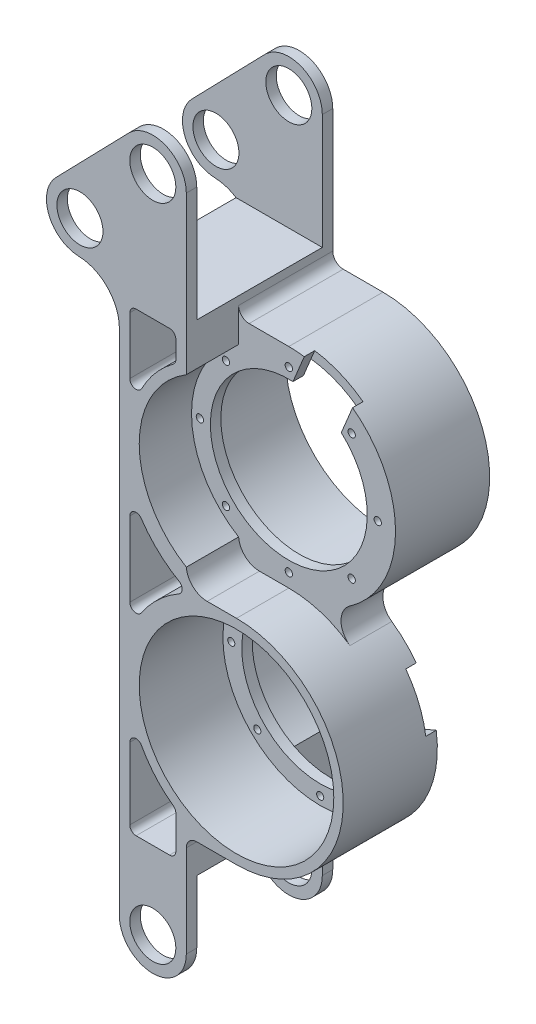
from build123d import *

# Parameters (mm, degrees)
SKETCH_1_R                = 11
EXTRUDE_1_DEPTH           = 70
FILLET_1_R                = 5
SKETCH_2_R                = 46.5
CUT_EXTRUDE_1_DEPTH       = 40
SKETCH_3_R                = 46.5
CUT_EXTRUDE_2_DEPTH       = 40
CUT_EXTRUDE_3_DEPTH       = 25
CUT_EXTRUDE_START         = -25
CUT_EXTRUDE_4_DEPTH       = 25
CUT_EXTRUDE_START_2       = -30
CUT_EXTRUDE_5_DEPTH       = 30
FILLET_2_R                = 10
CUT_EXTRUDE_6_DEPTH       = 346.603819461
CUT_EXTRUDE_6_DEPTH_BACK  = 346.603819461
SKETCH_8_R                = 37.5
CUT_EXTRUDE_7_DEPTH       = 347.534269631
CUT_EXTRUDE_7_DEPTH_BACK  = 347.534269631
SKETCH_9_W                = 60
SKETCH_9_H                = 60
SKETCH_9_H_2              = 100
CUT_EXTRUDE_8_DEPTH       = 351.34554376
CUT_EXTRUDE_8_DEPTH_BACK  = 351.34554376
CUT_EXTRUDE_9_DEPTH       = 351.34554376
CUT_EXTRUDE_9_DEPTH_BACK  = 351.34554376
FILLET_3_R                = 20
FILLET_4_R                = 3
SKETCH_12_R               = 46.5
CUT_EXTRUDE_10_DEPTH      = 25
SKETCH_13_R               = 46.5
CUT_EXTRUDE_11_DEPTH      = 25
CUT_EXTRUDE_12_DEPTH      = 351.345543854
CUT_EXTRUDE_12_DEPTH_BACK = 351.345543854
FILLET_5_R                = 10
FILLET_6_R                = 3
CUT_EXTRUDE_13_DEPTH      = 346.603819557
CUT_EXTRUDE_13_DEPTH_BACK = 346.603819557
SKETCH_15_R               = 1.75
SKETCH_15_R_2             = 1.7
CUT_EXTRUDE_14_DEPTH      = 5
CUT_EXTRUDE_15_DEPTH      = 5


with BuildPart() as part:
    # 草图1 → 凸台-拉伸1 (new body)
    with BuildSketch(Plane.XY):
        with BuildLine():
            Line((-11.476408706, 326.148634141), (-46.315890396, 290.284856933))
            ThreePointArc((-46.315890396, 290.284856933), (-49.576817715, 272.906381151), (-34.839481689, 263.136222792))
            Line((-34.839481689, 263.136222792), (-16, 263.136222792))
            Line((-16, 263.136222792), (-16, 0))
            ThreePointArc((-16, 0), (0, -16), (16, 0))
            Line((16, 0), (16, 49))
            Line((16, 49), (40, 49))
            ThreePointArc((40, 49), (76.062445841, 63.937554159), (91, 100))
            Line((91, 100), (91, 200))
            ThreePointArc((91, 200), (76.062445841, 236.062445841), (40, 251))
            Line((40, 251), (16, 251))
            Line((16, 251), (16, 315))
            ThreePointArc((16, 315), (6.01570697, 329.82603351), (-11.476408706, 326.148634141))
        make_face()
        with Locations((0, 315)):
            Circle(SKETCH_1_R, mode=Mode.SUBTRACT)
        Circle(SKETCH_1_R, mode=Mode.SUBTRACT)
        with Locations((-34.839481689, 279.136222792)):
            Circle(SKETCH_1_R, mode=Mode.SUBTRACT)
    extrude(amount=EXTRUDE_1_DEPTH)

    # 圆角1
    fillet_1_edges = [part.edges().sort_by_distance(p)[0] for p in [
        (16, 251, 35),
        (16, 49, 35),
    ]]
    fillet(fillet_1_edges, radius=FILLET_1_R)

    # 草图2 → 切除-拉伸1 (cut)
    with BuildSketch(Plane.XY.offset(70)):
        with Locations((40, 100)):
            Circle(SKETCH_2_R)
    extrude(amount=-CUT_EXTRUDE_1_DEPTH, mode=Mode.SUBTRACT)

    # 草图3 → 切除-拉伸2 (cut)
    with BuildSketch(Plane(origin=(0, 0, 0), x_dir=(-1, 0, 0), z_dir=(0, 0, -1))):
        with Locations((-40, 200)):
            Circle(SKETCH_3_R)
    extrude(amount=-CUT_EXTRUDE_2_DEPTH, mode=Mode.SUBTRACT)

    # 草图4 → 切除-拉伸3 (cut)
    with BuildSketch(Plane(origin=(0, 0, 0), x_dir=(-1, 0, 0), z_dir=(0, 0, -1))):
        with BuildLine():
            Line((-16, 44), (-16, 49))
            Line((-16, 49), (-16, 149))
            Line((-16, 149), (-40, 149))
            ThreePointArc((-40, 149), (-76.062445841, 163.937554159), (-91, 200))
            Line((-91, 200), (-91, 100))
            ThreePointArc((-91, 100), (-76.062445841, 63.937554159), (-40, 49))
            Line((-40, 49), (-21, 49))
            ThreePointArc((-21, 49), (-17.464466094, 47.535533906), (-16, 44))
        make_face()
    extrude(amount=-CUT_EXTRUDE_3_DEPTH, mode=Mode.SUBTRACT)

    # 草图5 → 切除-拉伸4 (cut)
    with BuildSketch(Plane.XY.offset(70).offset(CUT_EXTRUDE_START)):
        with BuildLine():
            Line((16, 251), (16, 256))
            ThreePointArc((16, 256), (17.464466094, 252.464466094), (21, 251))
            Line((21, 251), (40, 251))
            ThreePointArc((40, 251), (76.062445841, 236.062445841), (91, 200))
            Line((91, 200), (91, 100))
            ThreePointArc((91, 100), (76.062445841, 136.062445841), (40, 151))
            Line((40, 151), (16, 151))
            Line((16, 151), (16, 251))
        make_face()
    extrude(amount=CUT_EXTRUDE_4_DEPTH, mode=Mode.SUBTRACT)

    # 草图6 → 切除-拉伸5 (cut)
    with BuildSketch(Plane.XY.offset(45).offset(CUT_EXTRUDE_START_2)):
        with BuildLine():
            Line((91, 100), (91, 200))
            ThreePointArc((91, 200), (79.455947946, 167.685480482), (50.049875621, 150))
            ThreePointArc((50.049875621, 150), (79.455947946, 132.314519518), (91, 100))
        make_face()
    extrude(amount=CUT_EXTRUDE_5_DEPTH, mode=Mode.SUBTRACT)

    # 圆角2
    fillet_2_edges = [part.edges().sort_by_distance(p)[0] for p in [
        (50.049875621, 150, 35),
    ]]
    fillet(fillet_2_edges, radius=FILLET_2_R)

    # 草图8 → 切除-拉伸6 (cut, two sides: drawn at the far end of the back side and taken through both)
    with BuildSketch(Plane.XY.offset(30).offset(-CUT_EXTRUDE_6_DEPTH_BACK)):
        with Locations((40, 100)):
            Circle(SKETCH_8_R)
        with Locations(Location((40, 200, 0), (0, 0, 230.2081805))):
            Circle(SKETCH_8_R)
    extrude(amount=CUT_EXTRUDE_6_DEPTH + CUT_EXTRUDE_6_DEPTH_BACK, mode=Mode.SUBTRACT)

    # 草图9 → 切除-拉伸7 (cut, two sides: drawn at the far end of the back side and taken through both)
    with BuildSketch(Plane(origin=(16, 0, 0), x_dir=(0, 0, -1), z_dir=(1, 0, 0)).offset(-CUT_EXTRUDE_7_DEPTH_BACK)):
        with Locations((-35, 0)):
            Rectangle(SKETCH_9_W, SKETCH_9_H)
        with Locations((-35, 310)):
            Rectangle(SKETCH_9_W, SKETCH_9_H_2)
    extrude(amount=CUT_EXTRUDE_7_DEPTH + CUT_EXTRUDE_7_DEPTH_BACK, mode=Mode.SUBTRACT)

    # 草图10 → 切除-拉伸8 (cut, two sides: drawn at the far end of the back side and taken through both)
    with BuildSketch(Plane.XY.offset(70).offset(-CUT_EXTRUDE_8_DEPTH_BACK)):
        with BuildLine():
            Line((-11, 92.841089468), (-11, 37))
            Line((-11, 37), (11, 37))
            Line((11, 37), (11, 57.441217123))
            ThreePointArc((11, 57.441217123), (-3.74114471, 72.816139725), (-11, 92.841089468))
        make_face()
    extrude(amount=CUT_EXTRUDE_8_DEPTH + CUT_EXTRUDE_8_DEPTH_BACK, mode=Mode.SUBTRACT)

    # 草图11 → 切除-拉伸9 (cut, two sides: drawn at the far end of the back side and taken through both)
    with BuildSketch(Plane(origin=(0, 0, 0), x_dir=(-1, 0, 0), z_dir=(0, 0, -1)).offset(-CUT_EXTRUDE_9_DEPTH_BACK)):
        with BuildLine():
            Line((-11, 255), (11, 255))
            Line((11, 255), (11, 200))
            ThreePointArc((11, 200), (5.166359163, 223.685438565), (-11, 241.952353927))
            Line((-11, 241.952353927), (-11, 255))
        make_face()
    extrude(amount=CUT_EXTRUDE_9_DEPTH + CUT_EXTRUDE_9_DEPTH_BACK, mode=Mode.SUBTRACT)

    # 圆角3
    # the kernel refuses this fillet: 20 mm, written as the material it adds along each edge
    with BuildSketch(Plane(origin=(-16, 263.136222792, 0), x_dir=(0, -1, 0), z_dir=(0, 0, 1))) as fillet_3_piece_1_section:
        with BuildLine():
            CenterArc((19.981289544, -20), FILLET_3_R, 90, 88.152657689)
            Line((-0.008315758, -19.355267605), (-2.007276288, -19.290794366))
            ThreePointArc((-2.007276288, -19.290794366), (-2, -18.839481689), (-2, 0))
            Line((-2, 0), (0, 2))
            Line((0, 2), (19.981289544, 2))
            Line((19.981289544, 2), (19.981289544, 0))
        make_face()
    fillet_3_piece_1 = extrude(amount=54.95322386, mode=Mode.PRIVATE)
    fillet_3_piece_1 = split(fillet_3_piece_1, bisect_by=Plane(origin=(-18.420213864, 260, 2.5), z_dir=(0, -1, 0)), keep=Keep.TOP, mode=Mode.PRIVATE)
    add(fillet_3_piece_1)
    with BuildSketch(Plane(origin=(-16, 263.136222792, 0), x_dir=(0, -1, 0), z_dir=(0, 0, 1)), Plane(origin=(-16, 263.136222792, 65), x_dir=(0, -1, 0), z_dir=(0, 0, 1))) as fillet_3_piece_2:
        with BuildLine():
            CenterArc((19.981289544, -20), FILLET_3_R, 90, 88.152657689)
            Line((-0.008315758, -19.355267605), (-2.007276288, -19.290794366))
            ThreePointArc((-2.007276288, -19.290794366), (-2, -18.839481689), (-2, 0))
            Line((-2, 0), (0, 2))
            Line((0, 2), (19.981289544, 2))
            Line((19.981289544, 2), (19.981289544, 0))
        make_face()
    extrude(amount=5)
    with BuildSketch(Plane(origin=(-16, 263.136222792, 15.04677614), x_dir=(0, -1, 0), z_dir=(0, 0, 1))) as fillet_3_piece_3_section:
        with BuildLine():
            CenterArc((19.981289544, -20), FILLET_3_R, 90, 88.152657689)
            Line((-0.008315758, -19.355267605), (-2.007276288, -19.290794366))
            ThreePointArc((-2.007276288, -19.290794366), (-2, -18.839481689), (-2, 0))
            Line((-2, 0), (0, 2))
            Line((0, 2), (19.981289544, 2))
            Line((19.981289544, 2), (19.981289544, 0))
        make_face()
    fillet_3_piece_3 = extrude(amount=54.95322386, mode=Mode.PRIVATE)
    fillet_3_piece_3 = split(fillet_3_piece_3, bisect_by=Plane(origin=(-18.420213864, 260, 40.02338807), z_dir=(0, -1, 0)), keep=Keep.TOP, mode=Mode.PRIVATE)
    add(fillet_3_piece_3)

    # 圆角4
    fillet_4_edges = [part.edges().sort_by_distance(p)[0] for p in [
        (-11, 92.841089468, 35),
        (11, 57.441217123, 35),
        (11, 37, 35),
        (-11, 37, 35),
        (11, 241.952353927, 35),
        (11, 255, 35),
        (-11, 255, 35),
    ]]
    fillet(fillet_4_edges, radius=FILLET_4_R)
    fillet_4_2_edges = [part.edges().sort_by_distance(p)[0] for p in [
        (-11, 200, 35),
    ]]
    fillet(fillet_4_2_edges, radius=FILLET_4_R)

    # 草图12 → 切除-拉伸10 (cut)
    with BuildSketch(Plane(origin=(0, 0, 0), x_dir=(-1, 0, 0), z_dir=(0, 0, -1)).offset(CUT_EXTRUDE_START)):
        with Locations(Location((-40, 100, 0), (0, 0, 180))):
            Circle(SKETCH_12_R)
    extrude(amount=CUT_EXTRUDE_10_DEPTH, mode=Mode.SUBTRACT)

    # 草图13 → 切除-拉伸11 (cut)
    with BuildSketch(Plane.XY.offset(70).offset(CUT_EXTRUDE_START)):
        with Locations(Location((40, 200, 0), (0, 0, 180))):
            Circle(SKETCH_13_R)
    extrude(amount=CUT_EXTRUDE_11_DEPTH, mode=Mode.SUBTRACT)

    # 草图14 → 切除-拉伸12 (cut, two sides: drawn at the far end of the back side and taken through both)
    with BuildSketch(Plane.XY.offset(70).offset(-CUT_EXTRUDE_12_DEPTH_BACK)):
        with BuildLine():
            Line((-11, 180), (-11, 120))
            ThreePointArc((-11, 120), (0.360786501, 137.811807061), (17.616970714, 150))
            ThreePointArc((17.616970714, 150), (0.360786501, 162.188192939), (-11, 180))
        make_face()
    extrude(amount=CUT_EXTRUDE_12_DEPTH + CUT_EXTRUDE_12_DEPTH_BACK, mode=Mode.SUBTRACT)

    # 圆角5
    # the kernel refuses this fillet: 10 mm, written as the material it adds along each edge
    with BuildSketch(Plane(origin=(16, 151, 20.085794328), x_dir=(1, 0, 0), z_dir=(0, 0, 1))) as fillet_5_piece_1:
        with BuildLine():
            CenterArc((9.965682269, 10), FILLET_5_R, 184.748114609, 85.251885391)
            Line((0, 9.172245858), (-0.199313645, 9.155690775))
            ThreePointArc((-0.199313645, 9.155690775), (-0.2, 4.586122929), (-0.2, 0))
            Line((-0.2, 0), (0, -0.2))
            Line((0, -0.2), (9.965682269, -0.2))
            Line((9.965682269, -0.2), (9.965682269, 0))
        make_face()
    extrude(amount=49.914205672)
    with BuildSketch(Plane(origin=(16, 149, 0), x_dir=(0, -1, 0), z_dir=(0, 0, 1))) as fillet_5_piece_2:
        with BuildLine():
            CenterArc((10, 9.965682269), FILLET_5_R, 180, 85.251885391)
            Line((0, 9.965682269), (-0.2, 9.965682269))
            Line((-0.2, 9.965682269), (-0.2, 0))
            Line((-0.2, 0), (0, -0.2))
            ThreePointArc((0, -0.2), (4.586122929, -0.2), (9.155690775, -0.199313645))
            Line((9.155690775, -0.199313645), (9.172245858, 0))
        make_face()
    extrude(amount=49.914205672)

    # 圆角6
    fillet_6_edges = [part.edges().sort_by_distance(p)[0] for p in [
        (-11, 180, 35),
        (17.616970714, 150, 35),
        (-11, 120, 35),
    ]]
    fillet(fillet_6_edges, radius=FILLET_6_R)

    # 草图15 → 切除-拉伸13 (cut, two sides: drawn at the far end of the back side and taken through both)
    with BuildSketch(Plane.XY.offset(30).offset(-CUT_EXTRUDE_13_DEPTH_BACK)):
        with Locations((40, 242.5)):
            Circle(SKETCH_15_R)
        with Locations((70.0520382, 230.0520382)):
            Circle(SKETCH_15_R)
        with Locations((82.5, 200)):
            Circle(SKETCH_15_R)
        with Locations((70.0520382, 169.9479618)):
            Circle(SKETCH_15_R)
        with Locations((40, 157.5)):
            Circle(SKETCH_15_R)
        with Locations((9.9479618, 169.9479618)):
            Circle(SKETCH_15_R)
        with Locations((-2.5, 200)):
            Circle(SKETCH_15_R)
        with Locations((9.9479618, 230.0520382)):
            Circle(SKETCH_15_R)
        with Locations((40, 142.5)):
            Circle(SKETCH_15_R_2)
        with Locations((70.0520382, 130.0520382)):
            Circle(SKETCH_15_R_2)
        with Locations((82.5, 100)):
            Circle(SKETCH_15_R_2)
        with Locations((70.0520382, 69.9479618)):
            Circle(SKETCH_15_R_2)
        with Locations((40, 57.5)):
            Circle(SKETCH_15_R_2)
        with Locations((9.9479618, 69.9479618)):
            Circle(SKETCH_15_R_2)
        with Locations((-2.5, 100)):
            Circle(SKETCH_15_R_2)
        with Locations((9.9479618, 130.0520382)):
            Circle(SKETCH_15_R_2)
    extrude(amount=CUT_EXTRUDE_13_DEPTH + CUT_EXTRUDE_13_DEPTH_BACK, mode=Mode.SUBTRACT)

    # 草图16 → 切除-拉伸14 (cut)
    with BuildSketch(Plane(origin=(0, 0, 25), x_dir=(-1, 0, 0), z_dir=(0, 0, -1))):
        Polygon((-98.245518867, 137.655986366), (-107.812604676, 114.558998053), (-68.754054222, 98.380416728), (-59.186968413, 121.477405041), align=None)
    extrude(amount=-CUT_EXTRUDE_14_DEPTH, mode=Mode.SUBTRACT)

    # 草图17 → 切除-拉伸15 (cut)
    with BuildSketch(Plane.XY.offset(45)):
        Polygon((55.33392121, 269.68343467), (39.652485296, 231.825099411), (62.749473609, 222.258013602), (78.430909522, 260.116348861), align=None)
    extrude(amount=-CUT_EXTRUDE_15_DEPTH, mode=Mode.SUBTRACT)


solid = part.part
